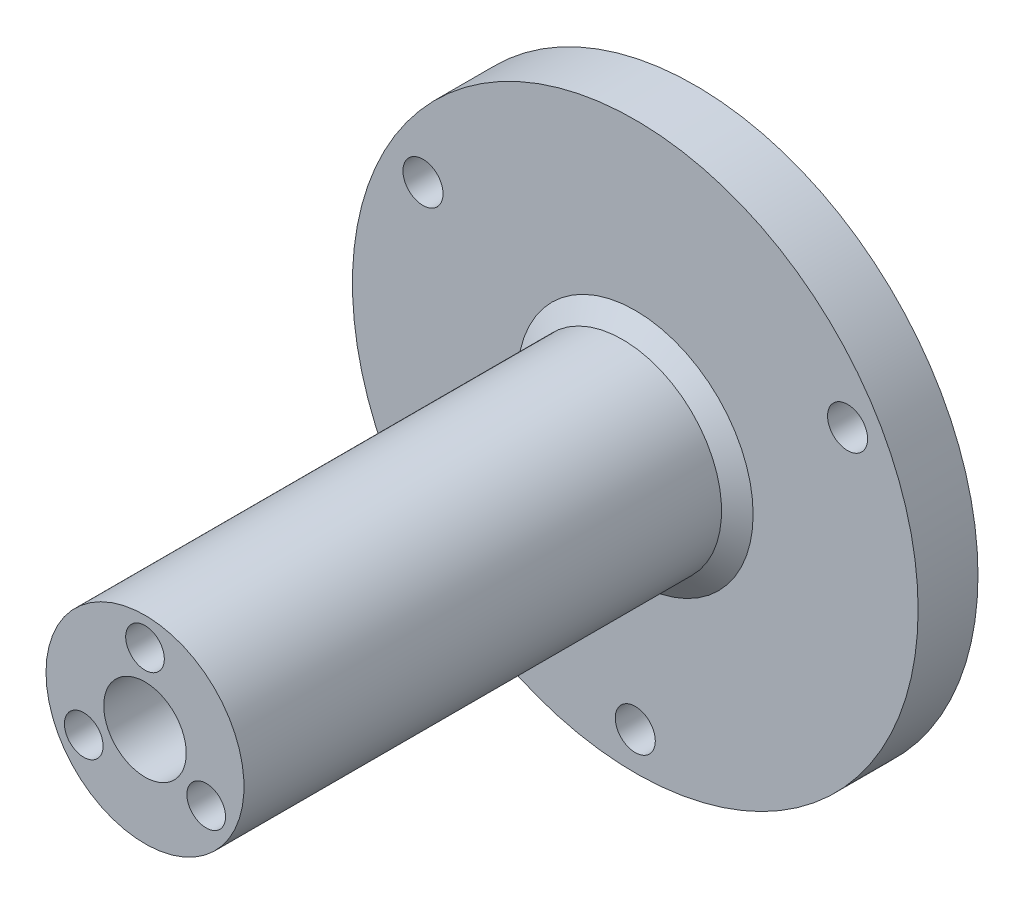
from build123d import *

# Parameters (mm, degrees)
ESQUISSE3_R         = 30
ESQUISSE3_R_2       = 2.125
ESQUISSE3_R_3       = 7.675
BOSS_EXTRU_1_DEPTH  = 6.35
ESQUISSE4_R         = 10.5
ESQUISSE4_R_2       = 7.675
BOSS_EXTRU_2_DEPTH  = 45
SKETCH1_R           = 10.5
SKETCH1_R_2         = 4.375
BOSS_EXTRUDE1_DEPTH = 7
SKETCH2_R           = 2.05
CUT_EXTRUDE1_DEPTH  = 6
CHAMFER2_SIZE       = 5.712592027
CHAMFER2_SIZE_2     = 4
CHAMFER3_SIZE       = 2
CHAMFER3_SIZE2      = 1.349017034


with BuildPart() as part:
    # Esquisse3 → Boss.-Extru.1 (new body)
    with BuildSketch(Plane.XY):
        Circle(ESQUISSE3_R)
        with Locations((-22.516660498, 13)):
            Circle(ESQUISSE3_R_2, mode=Mode.SUBTRACT)
        with Locations((22.516660498, 13)):
            Circle(ESQUISSE3_R_2, mode=Mode.SUBTRACT)
        with Locations((0, -26)):
            Circle(ESQUISSE3_R_2, mode=Mode.SUBTRACT)
        Circle(ESQUISSE3_R_3, mode=Mode.SUBTRACT)
    extrude(amount=BOSS_EXTRU_1_DEPTH)

    # Esquisse4 → Boss.-Extru.2 (add)
    with BuildSketch(Plane.XY.offset(6.35)):
        with Locations(Location((0, 0, 0), (0, 0, 180))):
            Circle(ESQUISSE4_R)
        Circle(ESQUISSE4_R_2, mode=Mode.SUBTRACT)
    extrude(amount=BOSS_EXTRU_2_DEPTH)

    # Sketch1 → Boss-Extrude1 (add)
    with BuildSketch(Plane.XY.offset(51.35)):
        with Locations(Location((0, 0, 0), (0, 0, 180))):
            Circle(SKETCH1_R)
        Circle(SKETCH1_R_2, mode=Mode.SUBTRACT)
    extrude(amount=BOSS_EXTRUDE1_DEPTH)

    # Sketch2 → Cut-Extrude1 (cut)
    with BuildSketch(Plane.XY.offset(58.35)):
        with Locations((0, 7.5)):
            Circle(SKETCH2_R)
        with Locations((-6.495190528, -3.75)):
            Circle(SKETCH2_R)
        with Locations((6.495190528, -3.75)):
            Circle(SKETCH2_R)
    extrude(amount=-CUT_EXTRUDE1_DEPTH, mode=Mode.SUBTRACT)

    # Chamfer2
    # the kernel refuses this chamfer: 5.712592027, 4 mm, written as the material it adds along each edge
    with BuildSketch(Plane(origin=(0, 0, 51.35), x_dir=(1, 0, 0), z_dir=(0, -1, 0))) as chamfer2_piece_1_section:
        Polygon((7.675, -CHAMFER2_SIZE), (7.675 - CHAMFER2_SIZE_2, 0), (7.675, 0), align=None)
    chamfer2_piece_1 = revolve(axis=Axis((0, 0, 51.35), (0, 0, 1)), mode=Mode.PRIVATE)
    chamfer2_piece_1 = chamfer2_piece_1 - Plane(origin=(0, 0, 47.945767055), x_dir=(1, 0, 0), z_dir=(0, 0, -1)) * Cylinder(4.375, 31, mode=Mode.PRIVATE)
    add(chamfer2_piece_1)

    # Chamfer3
    chamfer3_edges = [part.edges().sort_by_distance(p)[0] for p in [
        (10.5, 0, 6.35),
    ]]
    chamfer3_side = [part.faces().sort_by_distance(p)[0] for p in [
        (-29.151471863, 0, 6.35),
    ]]
    chamfer(chamfer3_edges, length=CHAMFER3_SIZE, length2=CHAMFER3_SIZE2, reference=chamfer3_side[0])


solid = part.part
